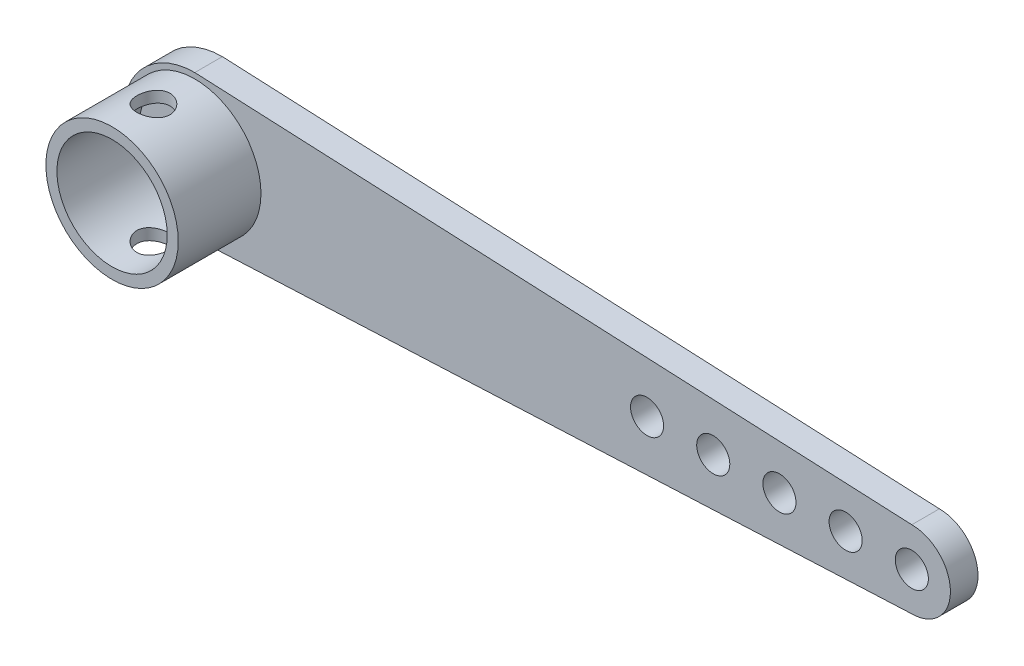
from build123d import *

# Parameters (mm, degrees)
DODANIE_WYCI_GNI_CIE1_DEPTH = 5
SZKIC5_R                    = 12
DODANIE_WYCI_GNI_CIE3_DEPTH = 15
SZKIC6_R                    = 10
WYTNIJ_WYCI_GNI_CIE1_DEPTH  = 15
SZKIC7_R                    = 3
WYTNIJ_WYCI_GNI_CIE2_DEPTH  = 21.5
SZKIC8_R                    = 3
WYTNIJ_WYCI_GNI_CIE3_DEPTH  = 43


with BuildPart() as part:
    # Szkic2 → Dodanie-wyciągnięcie1 (new body)
    with BuildSketch(Plane.XY):
        with BuildLine():
            ThreePointArc((0, 13), (-13, 0), (0, -13))
            Line((0, -13), (130, -7))
            ThreePointArc((130, -7), (137, 0), (130, 7))
            Line((130, 7), (0, 13))
        make_face()
    extrude(amount=DODANIE_WYCI_GNI_CIE1_DEPTH)

    # Szkic5 → Dodanie-wyciągnięcie3 (add)
    with BuildSketch(Plane.XY.offset(5)):
        Circle(SZKIC5_R)
    extrude(amount=DODANIE_WYCI_GNI_CIE3_DEPTH)

    # Szkic6 → Wytnij-wyciągnięcie1 (cut)
    with BuildSketch(Plane.XY.offset(20)):
        Circle(SZKIC6_R)
    extrude(amount=-WYTNIJ_WYCI_GNI_CIE1_DEPTH, mode=Mode.SUBTRACT)

    # Szkic7 → Wytnij-wyciągnięcie2 (cut, symmetric)
    with BuildSketch(Plane(origin=(0, 0, 0), x_dir=(1, 0, 0), z_dir=(0, 1, 0))):
        with Locations((0, -12.5)):
            Circle(SZKIC7_R)
    extrude(amount=WYTNIJ_WYCI_GNI_CIE2_DEPTH, both=True, mode=Mode.SUBTRACT)

    # Szkic8 → Wytnij-wyciągnięcie3 (cut)
    with BuildSketch(Plane.XY.offset(5)):
        with Locations((130, 0)):
            Circle(SZKIC8_R)
        with Locations((118, 0)):
            Circle(SZKIC8_R)
        with Locations((106, 0)):
            Circle(SZKIC8_R)
        with Locations((94, 0)):
            Circle(SZKIC8_R)
        with Locations((82, 0)):
            Circle(SZKIC8_R)
    extrude(amount=-WYTNIJ_WYCI_GNI_CIE3_DEPTH, mode=Mode.SUBTRACT)


solid = part.part
